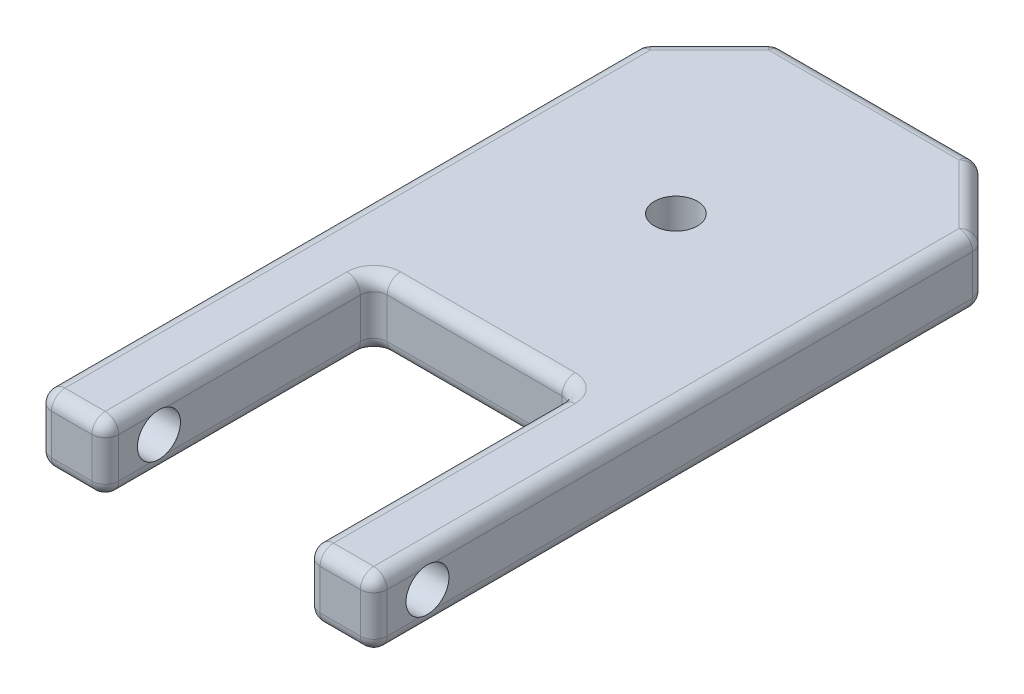
from build123d import *

# Parameters (mm, degrees)
SKETCH1_W           = 25
SKETCH1_H           = 50
BOSS_EXTRUDE1_DEPTH = 5
SKETCH3_W           = 15
SKETCH3_H           = 5
CUT_EXTRUDE1_DEPTH  = 20
SKETCH5_R           = 1.6
CUT_EXTRUDE4_DEPTH  = 48.5
SKETCH6_R           = 1.6
CUT_EXTRUDE5_DEPTH  = 48.5
CHAMFER1_SIZE       = 5
FILLET1_R           = 1


with BuildPart() as part:
    # Sketch1 → Boss-Extrude1 (new body)
    with BuildSketch(Plane(origin=(0, 0, 0), x_dir=(1, 0, 0), z_dir=(0, 1, 0))):
        Rectangle(SKETCH1_W, SKETCH1_H)
    extrude(amount=BOSS_EXTRUDE1_DEPTH)

    # Sketch3 → Cut-Extrude1 (cut)
    with BuildSketch(Plane.XY.offset(25)):
        with Locations((0, 2.5)):
            Rectangle(SKETCH3_W, SKETCH3_H)
    extrude(amount=-CUT_EXTRUDE1_DEPTH, mode=Mode.SUBTRACT)

    # Sketch5 → Cut-Extrude4 (cut)
    with BuildSketch(Plane(origin=(12.5, 0, 0), x_dir=(0, 0, -1), z_dir=(1, 0, 0))):
        with Locations((-21, 2.5)):
            Circle(SKETCH5_R)
    extrude(amount=-CUT_EXTRUDE4_DEPTH, mode=Mode.SUBTRACT)

    # Sketch6 → Cut-Extrude5 (cut)
    with BuildSketch(Plane(origin=(0, 5, 0), x_dir=(1, 0, 0), z_dir=(0, 1, 0))):
        with Locations(Location((0, 10, 0), (0, 0, 270))):
            Circle(SKETCH6_R)
    extrude(amount=-CUT_EXTRUDE5_DEPTH, mode=Mode.SUBTRACT)

    # Chamfer1
    chamfer1_edges = [part.edges().sort_by_distance(p)[0] for p in [
        (-12.5, 2.5, -25),
        (12.5, 2.5, -25),
    ]]
    chamfer(chamfer1_edges, length=CHAMFER1_SIZE)

    # Fillet1
    # the kernel refuses this fillet: 1 mm, written as the material it adds along each edge
    with BuildSketch(Plane(origin=(7.5, 0, 5), x_dir=(-1, 0, 0), z_dir=(0, 1, 0))) as fillet1_piece_1:
        with BuildLine():
            CenterArc((FILLET1_R, FILLET1_R), FILLET1_R, 180, 90)
            Line((0, FILLET1_R), (0, 0))
            Line((0, 0), (FILLET1_R, 0))
        make_face()
    extrude(amount=5)
    with BuildSketch(Plane(origin=(-7.5, 5, 5), x_dir=(0, 0, 1), z_dir=(0, -1, 0))) as fillet1_piece_2:
        with BuildLine():
            CenterArc((FILLET1_R, -FILLET1_R), FILLET1_R, 90, 90)
            Line((0, -FILLET1_R), (0, 0))
            Line((0, 0), (FILLET1_R, 0))
        make_face()
    extrude(amount=5)
    # the kernel refuses this fillet: 1 mm, written as the material it takes off along each edge
    with BuildSketch(Plane(origin=(11.5, 1, 24), x_dir=(1, 0, 0), z_dir=(0, -1, 0))) as fillet1_2_piece_1_section:
        Polygon((0, 0), (FILLET1_R, 0), (FILLET1_R, FILLET1_R), (0, FILLET1_R), align=None)
    fillet1_2_piece_1 = extrude(amount=FILLET1_R, mode=Mode.PRIVATE)
    fillet1_2_piece_1 = fillet1_2_piece_1 - Plane(origin=(11.5, 1, 24), x_dir=(-0.7071067811865475, 0, -0.7071067811865475), z_dir=(0, -1, 0)) * Sphere(FILLET1_R, mode=Mode.PRIVATE)
    add(fillet1_2_piece_1, mode=Mode.SUBTRACT)
    with BuildSketch(Plane(origin=(-11.5, 4, 24), x_dir=(0, 0, 1), z_dir=(-1, 0, 0))) as fillet1_2_piece_2_section:
        Polygon((0, 0), (FILLET1_R, 0), (FILLET1_R, FILLET1_R), (0, FILLET1_R), align=None)
    fillet1_2_piece_2 = extrude(amount=FILLET1_R, mode=Mode.PRIVATE)
    fillet1_2_piece_2 = fillet1_2_piece_2 - Plane(origin=(-11.5, 4, 24), x_dir=(0, -0.7071067811865475, -0.7071067811865475), z_dir=(-1, 0, 0)) * Sphere(FILLET1_R, mode=Mode.PRIVATE)
    add(fillet1_2_piece_2, mode=Mode.SUBTRACT)
    with BuildSketch(Plane(origin=(11.5, 4, 24), x_dir=(0, 0, 1), z_dir=(1, 0, 0))) as fillet1_2_piece_3_section:
        Polygon((0, 0), (FILLET1_R, 0), (FILLET1_R, -FILLET1_R), (0, -FILLET1_R), align=None)
    fillet1_2_piece_3 = extrude(amount=FILLET1_R, mode=Mode.PRIVATE)
    fillet1_2_piece_3 = fillet1_2_piece_3 - Plane(origin=(11.5, 4, 24), x_dir=(0, -0.7071067811865475, -0.7071067811865475), z_dir=(1, 0, 0)) * Sphere(FILLET1_R, mode=Mode.PRIVATE)
    add(fillet1_2_piece_3, mode=Mode.SUBTRACT)
    with BuildSketch(Plane(origin=(-11.5, 1, -19.585786438), x_dir=(-1, 0, 0), z_dir=(0, -1, 0))) as fillet1_2_piece_4_section:
        Polygon((0, 0), (FILLET1_R, 0), (FILLET1_R, FILLET1_R * 0.414213562373), (FILLET1_R * 0.707106781187, FILLET1_R * 0.707106781187), align=None)
    fillet1_2_piece_4 = extrude(amount=FILLET1_R, mode=Mode.PRIVATE)
    fillet1_2_piece_4 = fillet1_2_piece_4 - Plane(origin=(-11.5, 1, -19.585786438), x_dir=(0.9238795325112867, 0, 0.3826834323650898), z_dir=(0, -1, 0)) * Sphere(FILLET1_R, mode=Mode.PRIVATE)
    add(fillet1_2_piece_4, mode=Mode.SUBTRACT)
    with BuildSketch(Plane(origin=(-11.5, 1, 24), x_dir=(-1, 0, 0), z_dir=(0, -1, 0))) as fillet1_2_piece_5_section:
        Polygon((0, 0), (FILLET1_R, 0), (FILLET1_R, -FILLET1_R), (0, -FILLET1_R), align=None)
    fillet1_2_piece_5 = extrude(amount=FILLET1_R, mode=Mode.PRIVATE)
    fillet1_2_piece_5 = fillet1_2_piece_5 - Plane(origin=(-11.5, 1, 24), x_dir=(0.7071067811865475, 0, -0.7071067811865475), z_dir=(0, -1, 0)) * Sphere(FILLET1_R, mode=Mode.PRIVATE)
    add(fillet1_2_piece_5, mode=Mode.SUBTRACT)
    with BuildSketch(Plane(origin=(-11.5, 4, -19.585786438), x_dir=(-1, 0, 0), z_dir=(0, 1, 0))) as fillet1_2_piece_6_section:
        Polygon((0, 0), (FILLET1_R, 0), (FILLET1_R, -FILLET1_R * 0.414213562373), (FILLET1_R * 0.707106781187, -FILLET1_R * 0.707106781187), align=None)
    fillet1_2_piece_6 = extrude(amount=FILLET1_R, mode=Mode.PRIVATE)
    fillet1_2_piece_6 = fillet1_2_piece_6 - Plane(origin=(-11.5, 4, -19.585786438), x_dir=(0.9238795325112867, 0, 0.3826834323650898), z_dir=(0, 1, 0)) * Sphere(FILLET1_R, mode=Mode.PRIVATE)
    add(fillet1_2_piece_6, mode=Mode.SUBTRACT)
    with BuildSketch(Plane(origin=(7.085786438, 1, -24), x_dir=(0, 0, -1), z_dir=(0, -1, 0))) as fillet1_2_piece_7_section:
        Polygon((0, 0), (FILLET1_R, 0), (FILLET1_R, FILLET1_R * 0.414213562373), (FILLET1_R * 0.707106781187, FILLET1_R * 0.707106781187), align=None)
    fillet1_2_piece_7 = extrude(amount=FILLET1_R, mode=Mode.PRIVATE)
    fillet1_2_piece_7 = fillet1_2_piece_7 - Plane(origin=(7.085786438, 1, -24), x_dir=(-0.3826834323650898, 0, 0.9238795325112867), z_dir=(0, -1, 0)) * Sphere(FILLET1_R, mode=Mode.PRIVATE)
    add(fillet1_2_piece_7, mode=Mode.SUBTRACT)
    with BuildSketch(Plane(origin=(-7.085786438, 1, -24), x_dir=(-0.7071067811865476, 0, -0.7071067811865476), z_dir=(0, -1, 0))) as fillet1_2_piece_8_section:
        Polygon((0, 0), (FILLET1_R, 0), (FILLET1_R, FILLET1_R * 0.414213562373), (FILLET1_R * 0.707106781187, FILLET1_R * 0.707106781187), align=None)
    fillet1_2_piece_8 = extrude(amount=FILLET1_R, mode=Mode.PRIVATE)
    fillet1_2_piece_8 = fillet1_2_piece_8 - Plane(origin=(-7.085786438, 1, -24), x_dir=(0.3826834323650898, 0, 0.9238795325112867), z_dir=(0, -1, 0)) * Sphere(FILLET1_R, mode=Mode.PRIVATE)
    add(fillet1_2_piece_8, mode=Mode.SUBTRACT)
    with BuildSketch(Plane(origin=(11.5, 4, -19.585786438), x_dir=(0.7071067811865476, 0, -0.7071067811865476), z_dir=(0, 1, 0))) as fillet1_2_piece_9_section:
        Polygon((0, 0), (FILLET1_R, 0), (FILLET1_R, -FILLET1_R * 0.414213562373), (FILLET1_R * 0.707106781187, -FILLET1_R * 0.707106781187), align=None)
    fillet1_2_piece_9 = extrude(amount=FILLET1_R, mode=Mode.PRIVATE)
    fillet1_2_piece_9 = fillet1_2_piece_9 - Plane(origin=(11.5, 4, -19.585786438), x_dir=(-0.9238795325112867, 0, 0.3826834323650898), z_dir=(0, 1, 0)) * Sphere(FILLET1_R, mode=Mode.PRIVATE)
    add(fillet1_2_piece_9, mode=Mode.SUBTRACT)
    with BuildSketch(Plane(origin=(11.5, 1, -19.585786438), x_dir=(1, 0, 0), z_dir=(0, -1, 0))) as fillet1_2_piece_10_section:
        Polygon((0, 0), (FILLET1_R, 0), (FILLET1_R, -FILLET1_R * 0.414213562373), (FILLET1_R * 0.707106781187, -FILLET1_R * 0.707106781187), align=None)
    fillet1_2_piece_10 = extrude(amount=FILLET1_R, mode=Mode.PRIVATE)
    fillet1_2_piece_10 = fillet1_2_piece_10 - Plane(origin=(11.5, 1, -19.585786438), x_dir=(-0.9238795325112867, 0, 0.3826834323650898), z_dir=(0, -1, 0)) * Sphere(FILLET1_R, mode=Mode.PRIVATE)
    add(fillet1_2_piece_10, mode=Mode.SUBTRACT)
    with BuildSketch(Plane(origin=(7.085786438, 4, -24), x_dir=(0.7071067811865476, 0, -0.7071067811865476), z_dir=(0, 1, 0))) as fillet1_2_piece_11_section:
        Polygon((0, 0), (FILLET1_R, 0), (FILLET1_R, FILLET1_R * 0.414213562373), (FILLET1_R * 0.707106781187, FILLET1_R * 0.707106781187), align=None)
    fillet1_2_piece_11 = extrude(amount=FILLET1_R, mode=Mode.PRIVATE)
    fillet1_2_piece_11 = fillet1_2_piece_11 - Plane(origin=(7.085786438, 4, -24), x_dir=(-0.3826834323650898, 0, 0.9238795325112867), z_dir=(0, 1, 0)) * Sphere(FILLET1_R, mode=Mode.PRIVATE)
    add(fillet1_2_piece_11, mode=Mode.SUBTRACT)
    with BuildSketch(Plane(origin=(-7.085786438, 4, -24), x_dir=(-0.7071067811865476, 0, -0.7071067811865476), z_dir=(0, 1, 0))) as fillet1_2_piece_12_section:
        Polygon((0, 0), (FILLET1_R, 0), (FILLET1_R, -FILLET1_R * 0.414213562373), (FILLET1_R * 0.707106781187, -FILLET1_R * 0.707106781187), align=None)
    fillet1_2_piece_12 = extrude(amount=FILLET1_R, mode=Mode.PRIVATE)
    fillet1_2_piece_12 = fillet1_2_piece_12 - Plane(origin=(-7.085786438, 4, -24), x_dir=(0.3826834323650898, 0, 0.9238795325112867), z_dir=(0, 1, 0)) * Sphere(FILLET1_R, mode=Mode.PRIVATE)
    add(fillet1_2_piece_12, mode=Mode.SUBTRACT)
    with BuildSketch(Plane(origin=(5, 0, 25), x_dir=(0, 0, -1), z_dir=(1, 0, 0)), Plane(origin=(-11.5, 5, 25), x_dir=(0, -1, 0), z_dir=(1, 0, 0)), Plane(origin=(5, 5, 25), x_dir=(0, -1, 0), z_dir=(1, 0, 0)), Plane(origin=(-11.5, 0, 25), x_dir=(0, 0, -1), z_dir=(1, 0, 0))) as fillet1_2_piece_13:
        with BuildLine():
            CenterArc((FILLET1_R, FILLET1_R), FILLET1_R, 180, 90)
            Line((0, FILLET1_R), (0, 0))
            Line((0, 0), (FILLET1_R, 0))
        make_face()
    extrude(amount=6.5, mode=Mode.SUBTRACT)
    with BuildSketch(Plane(origin=(-7.5, 7.5, 25), x_dir=(-1, 0, 0), z_dir=(0, -1, 0))) as fillet1_2_piece_14:
        with BuildLine():
            CenterArc((FILLET1_R, FILLET1_R), FILLET1_R, 180, 90)
            Line((0, FILLET1_R), (0, 0))
            Line((0, 0), (FILLET1_R, 0))
        make_face()
    extrude(amount=10, mode=Mode.SUBTRACT)
    with BuildSketch(Plane(origin=(7.5, -2.5, 25), x_dir=(0, 0, -1), z_dir=(0, 1, 0))) as fillet1_2_piece_15:
        with BuildLine():
            CenterArc((FILLET1_R, -FILLET1_R), FILLET1_R, 90, 90)
            Line((0, -FILLET1_R), (0, 0))
            Line((0, 0), (FILLET1_R, 0))
        make_face()
    extrude(amount=10, mode=Mode.SUBTRACT)
    with BuildSketch(Plane(origin=(-12.5, 0, -19.585786438), x_dir=(1, 0, 0), z_dir=(0, 0, 1)), Plane(origin=(-12.5, 5, -19.585786438), x_dir=(0, -1, 0), z_dir=(0, 0, 1)), Plane(origin=(12.5, 5, 24), x_dir=(0, -1, 0), z_dir=(0, 0, -1)), Plane(origin=(12.5, 0, 24), x_dir=(-1, 0, 0), z_dir=(0, 0, -1))) as fillet1_2_piece_16:
        with BuildLine():
            CenterArc((FILLET1_R, FILLET1_R), FILLET1_R, 180, 90)
            Line((0, FILLET1_R), (0, 0))
            Line((0, 0), (FILLET1_R, 0))
        make_face()
    extrude(amount=43.585786438, mode=Mode.SUBTRACT)
    with BuildSketch(Plane(origin=(-12.5, 1, -20), x_dir=(0, 0, 1), z_dir=(0, 1, 0)), Plane(origin=(7.5, 1, -25), x_dir=(-1, 0, 0), z_dir=(0, 1, 0)), Plane(origin=(-7.5, 1, -25), x_dir=(-0.7071067811865486, 0, 0.7071067811865465), z_dir=(0, 1, 0)), Plane(origin=(12.5, 1, -20), x_dir=(-0.7071067811865475, 0, -0.7071067811865475), z_dir=(0, 1, 0))) as fillet1_2_piece_17:
        with BuildLine():
            CenterArc((FILLET1_R * 0.414213562373, FILLET1_R), FILLET1_R, 225, 45)
            Line((-FILLET1_R * 0.292893218813, FILLET1_R * 0.292893218813), (0, 0))
            Line((0, 0), (FILLET1_R * 0.414213562373, 0))
        make_face()
    extrude(amount=3, mode=Mode.SUBTRACT)
    with BuildSketch(Plane(origin=(7.085786438, 0, -25), x_dir=(0, 0, 1), z_dir=(-1, 0, 0)), Plane(origin=(7.085786438, 5, -25), x_dir=(0, -1, 0), z_dir=(-1, 0, 0))) as fillet1_2_piece_18:
        with BuildLine():
            CenterArc((FILLET1_R, FILLET1_R), FILLET1_R, 180, 90)
            Line((0, FILLET1_R), (0, 0))
            Line((0, 0), (FILLET1_R, 0))
        make_face()
    extrude(amount=14.171572875, mode=Mode.SUBTRACT)
    with BuildSketch(Plane(origin=(7.792893219, 0, -24.707106781), x_dir=(-0.7071067811865475, 0, 0.7071067811865475), z_dir=(0.7071067811865476, 0, 0.7071067811865476)), Plane(origin=(-12.207106781, 0, -20.292893219), x_dir=(0.7071067811865476, 0, 0.7071067811865476), z_dir=(0.7071067811865476, 0, -0.7071067811865476)), Plane(origin=(7.792893219, 5, -24.707106781), x_dir=(0, -1, 0), z_dir=(0.7071067811865476, 0, 0.7071067811865476)), Plane(origin=(-12.207106781, 5, -20.292893219), x_dir=(0, -1, 0), z_dir=(0.7071067811865476, 0, -0.7071067811865476))) as fillet1_2_piece_19:
        with BuildLine():
            CenterArc((FILLET1_R, -FILLET1_R), FILLET1_R, 90, 90)
            Line((0, -FILLET1_R), (0, 0))
            Line((0, 0), (FILLET1_R, 0))
        make_face()
    extrude(amount=6.242640687, mode=Mode.SUBTRACT)
    with BuildSketch(Plane(origin=(12.5, 1, 25), x_dir=(0, 0, -1), z_dir=(0, 1, 0))) as fillet1_2_piece_20:
        with BuildLine():
            CenterArc((FILLET1_R, FILLET1_R), FILLET1_R, 180, 90)
            Line((0, FILLET1_R), (0, 0))
            Line((0, 0), (FILLET1_R, 0))
        make_face()
    extrude(amount=3, mode=Mode.SUBTRACT)
    with BuildSketch(Plane(origin=(-12.5, 1, 25), x_dir=(0, 0, -1), z_dir=(0, 1, 0))) as fillet1_2_piece_21:
        with BuildLine():
            CenterArc((FILLET1_R, -FILLET1_R), FILLET1_R, 90, 90)
            Line((0, -FILLET1_R), (0, 0))
            Line((0, 0), (FILLET1_R, 0))
        make_face()
    extrude(amount=3, mode=Mode.SUBTRACT)
    # the kernel refuses this fillet: 1 mm, written as the material it takes off along each edge
    with BuildSketch(Plane(origin=(-8.5, 1, 24), x_dir=(1, 0, 0), z_dir=(0, -1, 0))) as fillet1_3_piece_1_section:
        Polygon((0, 0), (FILLET1_R, 0), (FILLET1_R, FILLET1_R), (0, FILLET1_R), align=None)
    fillet1_3_piece_1 = extrude(amount=FILLET1_R, mode=Mode.PRIVATE)
    fillet1_3_piece_1 = fillet1_3_piece_1 - Plane(origin=(-8.5, 1, 24), x_dir=(-0.7071067811865475, 0, -0.7071067811865475), z_dir=(0, -1, 0)) * Sphere(FILLET1_R, mode=Mode.PRIVATE)
    add(fillet1_3_piece_1, mode=Mode.SUBTRACT)
    with BuildSketch(Plane(origin=(8.5, 1, 24), x_dir=(-1, 0, 0), z_dir=(0, -1, 0))) as fillet1_3_piece_2_section:
        Polygon((0, 0), (FILLET1_R, 0), (FILLET1_R, -FILLET1_R), (0, -FILLET1_R), align=None)
    fillet1_3_piece_2 = extrude(amount=FILLET1_R, mode=Mode.PRIVATE)
    fillet1_3_piece_2 = fillet1_3_piece_2 - Plane(origin=(8.5, 1, 24), x_dir=(0.7071067811865475, 0, -0.7071067811865475), z_dir=(0, -1, 0)) * Sphere(FILLET1_R, mode=Mode.PRIVATE)
    add(fillet1_3_piece_2, mode=Mode.SUBTRACT)
    with BuildSketch(Plane(origin=(8.5, 4, 24), x_dir=(0, 1, 0), z_dir=(-1, 0, 0))) as fillet1_3_piece_3_section:
        Polygon((0, 0), (FILLET1_R, 0), (FILLET1_R, -FILLET1_R), (0, -FILLET1_R), align=None)
    fillet1_3_piece_3 = extrude(amount=FILLET1_R, mode=Mode.PRIVATE)
    fillet1_3_piece_3 = fillet1_3_piece_3 - Plane(origin=(8.5, 4, 24), x_dir=(0, -0.7071067811865475, -0.7071067811865475), z_dir=(-1, 0, 0)) * Sphere(FILLET1_R, mode=Mode.PRIVATE)
    add(fillet1_3_piece_3, mode=Mode.SUBTRACT)
    with BuildSketch(Plane(origin=(-8.5, 4, 24), x_dir=(0, 1, 0), z_dir=(1, 0, 0))) as fillet1_3_piece_4_section:
        Polygon((0, 0), (FILLET1_R, 0), (FILLET1_R, FILLET1_R), (0, FILLET1_R), align=None)
    fillet1_3_piece_4 = extrude(amount=FILLET1_R, mode=Mode.PRIVATE)
    fillet1_3_piece_4 = fillet1_3_piece_4 - Plane(origin=(-8.5, 4, 24), x_dir=(0, -0.7071067811865475, -0.7071067811865475), z_dir=(1, 0, 0)) * Sphere(FILLET1_R, mode=Mode.PRIVATE)
    add(fillet1_3_piece_4, mode=Mode.SUBTRACT)
    with BuildSketch(Plane(origin=(6.5, 5, 5), x_dir=(0, -1, 0), z_dir=(-1, 0, 0))) as fillet1_3_piece_5:
        with BuildLine():
            CenterArc((FILLET1_R, -FILLET1_R), FILLET1_R, 90, 90)
            Line((0, -FILLET1_R), (0, 0))
            Line((0, 0), (FILLET1_R, 0))
        make_face()
    extrude(amount=13, mode=Mode.SUBTRACT)
    with BuildSketch(Plane(origin=(-7.5, 5, 24), x_dir=(0, -1, 0), z_dir=(0, 0, -1)), Plane(origin=(-7.5, 0, 24), x_dir=(-1, 0, 0), z_dir=(0, 0, -1))) as fillet1_3_piece_6:
        with BuildLine():
            CenterArc((FILLET1_R, FILLET1_R), FILLET1_R, 180, 90)
            Line((0, FILLET1_R), (0, 0))
            Line((0, 0), (FILLET1_R, 0))
        make_face()
    extrude(amount=18, mode=Mode.SUBTRACT)
    with BuildSketch(Plane(origin=(7.5, 5, 24), x_dir=(0, -1, 0), z_dir=(0, 0, -1)), Plane(origin=(7.5, 0, 24), x_dir=(1, 0, 0), z_dir=(0, 0, -1))) as fillet1_3_piece_7:
        with BuildLine():
            CenterArc((FILLET1_R, -FILLET1_R), FILLET1_R, 90, 90)
            Line((0, -FILLET1_R), (0, 0))
            Line((0, 0), (FILLET1_R, 0))
        make_face()
    extrude(amount=18, mode=Mode.SUBTRACT)
    with BuildSketch(Plane(origin=(-6.5, 0, 5), x_dir=(0, 0, -1), z_dir=(1, 0, 0))) as fillet1_3_piece_8:
        with BuildLine():
            CenterArc((FILLET1_R, FILLET1_R), FILLET1_R, 180, 90)
            Line((0, FILLET1_R), (0, 0))
            Line((0, 0), (FILLET1_R, 0))
        make_face()
    extrude(amount=13, mode=Mode.SUBTRACT)
    with BuildSketch(Plane(origin=(-6.5, 0, 6), x_dir=(-1, 0, 0), z_dir=(0, 0, 1))) as fillet1_3_piece_9:
        with BuildLine():
            CenterArc((1 + FILLET1_R, -FILLET1_R), FILLET1_R, 90, 90)
            Line((1, -FILLET1_R), (1, 0))
            Line((1, 0), (1 + FILLET1_R, 0))
        make_face()
    revolve(axis=Axis((-6.5, 0, 6), (0, -1, 0)), revolution_arc=90, mode=Mode.SUBTRACT)
    with BuildSketch(Plane(origin=(6.5, 0, 6), x_dir=(0, 0, -1), z_dir=(-1, 0, 0))) as fillet1_3_piece_10:
        with BuildLine():
            CenterArc((1 + FILLET1_R, -FILLET1_R), FILLET1_R, 90, 90)
            Line((1, -FILLET1_R), (1, 0))
            Line((1, 0), (1 + FILLET1_R, 0))
        make_face()
    revolve(axis=Axis((6.5, 0, 6), (0, -1, 0)), revolution_arc=90, mode=Mode.SUBTRACT)
    with BuildSketch(Plane(origin=(6.5, 5, 6), x_dir=(0, 0, -1), z_dir=(-1, 0, 0))) as fillet1_3_piece_11:
        with BuildLine():
            CenterArc((1 + FILLET1_R, FILLET1_R), FILLET1_R, 180, 90)
            Line((1 + FILLET1_R, 0), (1, 0))
            Line((1, 0), (1, FILLET1_R))
        make_face()
    revolve(axis=Axis((6.5, 5, 6), (0, -1, 0)), revolution_arc=90, mode=Mode.SUBTRACT)
    with BuildSketch(Plane(origin=(-6.5, 5, 6), x_dir=(-1, 0, 0), z_dir=(0, 0, 1))) as fillet1_3_piece_12:
        with BuildLine():
            CenterArc((1 + FILLET1_R, FILLET1_R), FILLET1_R, 180, 90)
            Line((1 + FILLET1_R, 0), (1, 0))
            Line((1, 0), (1, FILLET1_R))
        make_face()
    revolve(axis=Axis((-6.5, 5, 6), (0, -1, 0)), revolution_arc=90, mode=Mode.SUBTRACT)


solid = part.part
